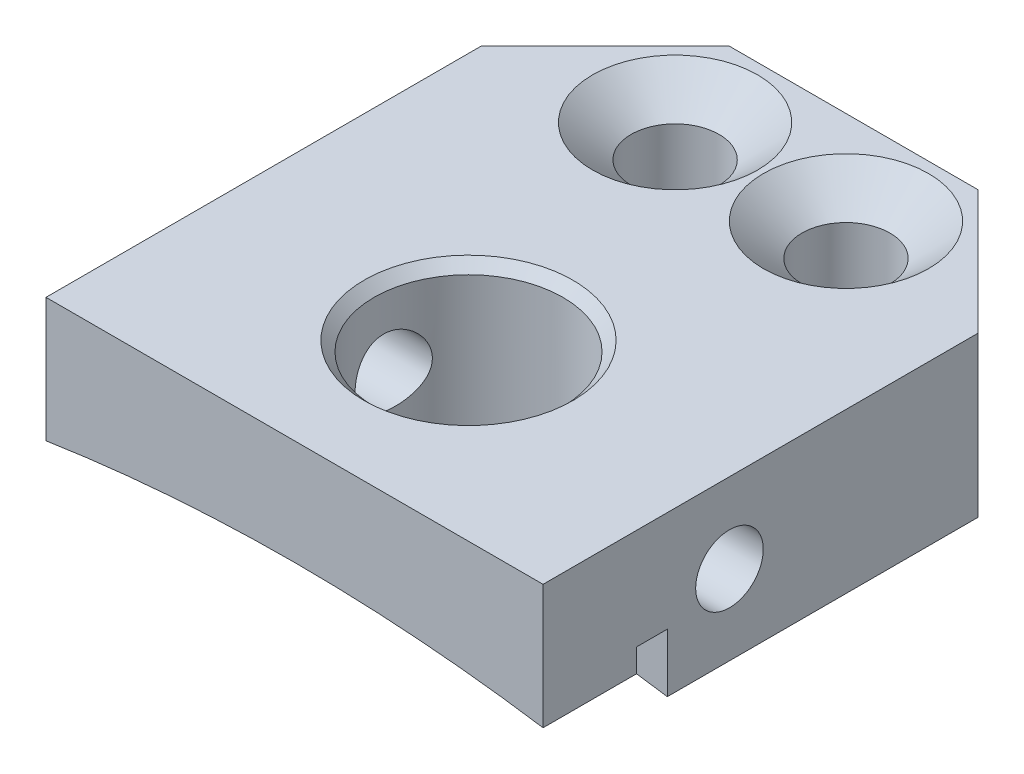
from build123d import *

# Parameters (mm, degrees)
BOSS_EXTRUDE1_DEPTH                               = 6.35
CUT_EXTRUDE1_DEPTH                                = 41.862908972
CUT_EXTRUDE1_DEPTH_BACK                           = 41.862908972
SKETCH2_R                                         = 83.82
BOSS_EXTRUDE2_DEPTH                               = 22.225
CHAMFER1_SIZE                                     = 6.35
CSK_FOR_8_FLAT_HEAD_MACHINE_SCREW_100_D           = 4.4958
CSK_FOR_8_FLAT_HEAD_MACHINE_SCREW_100_CSINK_D     = 8.4328
CSK_FOR_8_FLAT_HEAD_MACHINE_SCREW_100_CSINK_ANGLE = 100
SKETCH6_R                                         = 1.524
CUT_EXTRUDE2_DEPTH                                = 34.704349441
SKETCH7_W                                         = 1.5875
SKETCH7_H                                         = 2.989850087
CUT_EXTRUDE3_DEPTH                                = 31.694162248
SKETCH8_R                                         = 4.826
CUT_EXTRUDE4_DEPTH                                = 34.704349441
CHAMFER2_SIZE                                     = 0.508
F_8_32_TAPPED_HOLE1_D                             = 3.4544


with BuildPart() as part:
    # Sketch1 → Boss-Extrude1 (new body)
    with BuildSketch(Plane(origin=(0, 0, 0), x_dir=(1, 0, 0), z_dir=(0, 1, 0))):
        Polygon((-28.511825699, 9.670271113), (-22.161825699, 16.020271113), (-9.461825699, 16.020271113), (-3.111825699, 9.670271113), (-3.111825699, -12.554728887), (-28.511825699, -12.554728887), align=None)
    extrude(amount=BOSS_EXTRUDE1_DEPTH)

    # Sketch2 → Cut-Extrude1 (cut, two sides: drawn at the far end of the back side and taken through both)
    with BuildSketch(Plane.XY.offset(12.554728887).offset(-CUT_EXTRUDE1_DEPTH_BACK)):
        with Locations((-15.811825699, -82.852292666)):
            Circle(SKETCH2_R)
    extrude(amount=CUT_EXTRUDE1_DEPTH + CUT_EXTRUDE1_DEPTH_BACK, mode=Mode.SUBTRACT)

    # Sketch5 → Boss-Extrude2 (add)
    with BuildSketch(Plane(origin=(0, 0, -16.020271113), x_dir=(-1, 0, 0), z_dir=(0, 0, -1))):
        with BuildLine():
            Line((3.111825699, 6.35), (3.111825699, 0))
            Line((3.111825699, 0), (3.111825699, -1.799225087))
            ThreePointArc((3.111825699, -1.799225087), (15.811825699, -0.810292666), (28.511825699, -1.799225087))
            Line((28.511825699, -1.799225087), (28.511825699, 0))
            Line((28.511825699, 0), (28.511825699, 6.35))
            Line((28.511825699, 6.35), (3.111825699, 6.35))
        make_face()
    extrude(amount=-BOSS_EXTRUDE2_DEPTH)

    # Chamfer1
    chamfer1_edges = [part.edges().sort_by_distance(p)[0] for p in [
        (-28.511825699, 2.275387457, -16.020271113),
        (-3.111825699, 2.275387457, -16.020271113),
    ]]
    chamfer(chamfer1_edges, length=CHAMFER1_SIZE)

    # CSK for #8 Flat Head Machine Screw (100)1 (through all)
    with Locations(Plane(origin=(0, 6.35, 0), x_dir=(1, 0, 0), z_dir=(0, 1, 0))):
        with Locations((-20.177450699, 11.257771113), (-11.446200699, 11.257771113)):
            CounterSinkHole(CSK_FOR_8_FLAT_HEAD_MACHINE_SCREW_100_D / 2, CSK_FOR_8_FLAT_HEAD_MACHINE_SCREW_100_CSINK_D / 2, counter_sink_angle=CSK_FOR_8_FLAT_HEAD_MACHINE_SCREW_100_CSINK_ANGLE)

    # Sketch6 → Cut-Extrude2 (cut, through all)
    with BuildSketch(Plane(origin=(0, 6.35, 0), x_dir=(1, 0, 0), z_dir=(0, 1, 0))):
        with Locations((-15.811825699, -3.664728887)):
            Circle(SKETCH6_R)
    extrude(amount=-CUT_EXTRUDE2_DEPTH, mode=Mode.SUBTRACT)

    # Sketch7 → Cut-Extrude3 (cut, through all)
    with BuildSketch(Plane(origin=(-3.111825699, 0, 0), x_dir=(0, 0, -1), z_dir=(1, 0, 0))):
        with Locations((-6.998478887, -0.304300044)):
            Rectangle(SKETCH7_W, SKETCH7_H)
    extrude(amount=-CUT_EXTRUDE3_DEPTH, mode=Mode.SUBTRACT)

    # Sketch8 → Cut-Extrude4 (cut, through all)
    with BuildSketch(Plane(origin=(0, 6.35, 0), x_dir=(1, 0, 0), z_dir=(0, 1, 0))):
        with Locations((-15.811825699, -3.664728887)):
            Circle(SKETCH8_R)
    extrude(amount=-CUT_EXTRUDE4_DEPTH, mode=Mode.SUBTRACT)

    # Chamfer2
    chamfer2_edges = [part.edges().sort_by_distance(p)[0] for p in [
        (-20.637825699, 6.35, 3.664728887),
    ]]
    chamfer(chamfer2_edges, length=CHAMFER2_SIZE)

    # #8-32 Tapped Hole1 (through all)
    with Locations(Plane.ZY.offset(28.511825699)):
        with Locations((3.029728887, 2.275387457)):
            Hole(F_8_32_TAPPED_HOLE1_D / 2)


solid = part.part
